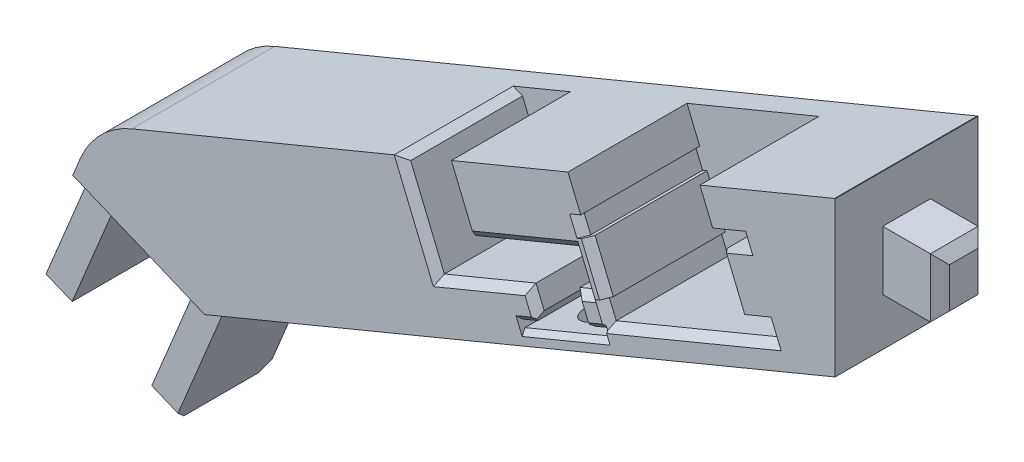
from build123d import *

# Parameters (mm, degrees)
BOSS_EXTRUDE1_DEPTH = 30
SKETCH4_W           = 30
SKETCH4_H           = 11.480502971
BOSS_EXTRUDE2_DEPTH = 50
CUT_EXTRUDE1_DEPTH  = 5
CUT_EXTRUDE3_DEPTH  = 6.480502971
FILLET1_R           = 10
CHAMFER3_SIZE       = 22.5
CHAMFER3_SIZE2      = 8.610377228
CHAMFER1_SIZE       = 15
CHAMFER1_SIZE2      = 20.645728807
CHAMFER2_SIZE2      = 20.645728807
CHAMFER2_SIZE       = 15
CUT_EXTRUDE4_DEPTH  = 25
CUT_EXTRUDE5_DEPTH  = 25
SKETCH9_W           = 20.645728807
SKETCH9_H           = 30
CUT_EXTRUDE6_DEPTH  = 40
SKETCH10_W          = 10
SKETCH10_H          = 12.413129657
BOSS_EXTRUDE3_DEPTH = 12
SKETCH11_W          = 20
SKETCH11_H          = 25.5
CUT_EXTRUDE7_DEPTH  = 4
SKETCH12_W          = 30
SKETCH12_H          = 31
CUT_EXTRUDE8_DEPTH  = 2
CHAMFER4_SIZE       = 1.5
CUT_EXTRUDE9_DEPTH  = 30
SKETCH14_W          = 5.95
SKETCH14_H          = 19.8
BOSS_EXTRUDE4_DEPTH = 30
FILLET2_R           = 20
CHAMFER5_SIZE       = 2
CHAMFER6_SIZE       = 1.5
BOSS_EXTRUDE5_DEPTH = 25.5
SKETCH16_W          = 4.6
SKETCH16_H          = 2.6
BOSS_EXTRUDE6_DEPTH = 10
CHAMFER7_SIZE       = 1
FILLET3_R           = 5


# Some blends are built 0.0001 mm under size
with BuildPart() as part:
    # Sketch1 → Boss-Extrude1 (new body)
    with BuildSketch(Plane.XY):
        Polygon((0, 216.478440058), (-153.073372946, 153.073372946), (-216.478440058, 0), (-244.194826034, 0), (-244.194826034, 11.480502971), (-176.034378888, 176.034378888), (0, 248.950206067), align=None)
    extrude(amount=BOSS_EXTRUDE1_DEPTH)

    # Sketch4 → Boss-Extrude2 (add)
    with BuildSketch(Plane.ZY.offset(244.194826034)):
        with Locations((15, 5.740251485)):
            Rectangle(SKETCH4_W, SKETCH4_H)
    extrude(amount=BOSS_EXTRUDE2_DEPTH)

    # Sketch5 → Cut-Extrude1 (cut)
    with BuildSketch(Plane(origin=(0, 11.480502971, 0), x_dir=(1, 0, 0), z_dir=(0, 1, 0))):
        with BuildLine():
            Line((-281.694826034, -6), (-256.694826034, -6))
            ThreePointArc((-256.694826034, -6), (-247.694826034, -15), (-256.694826034, -24))
            Line((-256.694826034, -24), (-281.694826034, -24))
            ThreePointArc((-281.694826034, -24), (-290.694826034, -15), (-281.694826034, -6))
        make_face()
    extrude(amount=-CUT_EXTRUDE1_DEPTH, mode=Mode.SUBTRACT)

    # Sketch7 → Cut-Extrude3 (cut)
    with BuildSketch(Plane(origin=(0, 6.480502971, 0), x_dir=(1, 0, 0), z_dir=(0, 1, 0))):
        with BuildLine():
            Line((-256.694826034, -11.5), (-281.694826034, -11.5))
            ThreePointArc((-281.694826034, -11.5), (-285.194826034, -15), (-281.694826034, -18.5))
            Line((-281.694826034, -18.5), (-256.694826034, -18.5))
            ThreePointArc((-256.694826034, -18.5), (-253.194826034, -15), (-256.694826034, -11.5))
        make_face()
    extrude(amount=-CUT_EXTRUDE3_DEPTH, mode=Mode.SUBTRACT)

    # Fillet1
    fillet1_edges = [part.edges().sort_by_distance(p)[0] for p in [
        (-294.194826034, 5.740251485, 0),
        (-294.194826034, 5.740251485, 30),
    ]]
    fillet(fillet1_edges, radius=FILLET1_R)

    # Chamfer3
    chamfer3_edges = [part.edges().sort_by_distance(p)[0] for p in [
        (0, 248.950206067, 15),
    ]]
    chamfer3_side = [part.faces().sort_by_distance(p)[0] for p in [
        (-88.017189444, 212.492292478, 15),
    ]]
    chamfer(chamfer3_edges, length=CHAMFER3_SIZE, length2=CHAMFER3_SIZE2, reference=chamfer3_side[0])

    # Chamfer1
    chamfer1_edges = [part.edges().sort_by_distance(p)[0] for p in [
        (0, 228.409134449, 0),
    ]]
    chamfer1_side = [part.faces().sort_by_distance(p)[0] for p in [
        (0, 228.409134449, 15),
    ]]
    chamfer(chamfer1_edges, length=CHAMFER1_SIZE, length2=CHAMFER1_SIZE2, reference=chamfer1_side[0])

    # Chamfer2
    chamfer2_edges = [part.edges().sort_by_distance(p)[0] for p in [
        (0, 228.409134449, 30),
    ]]
    chamfer2_side = [part.faces().sort_by_distance(p)[0] for p in [
        (0, 228.409134449, 29.7),
    ]]
    chamfer(chamfer2_edges, length=CHAMFER2_SIZE - 0.0001, length2=CHAMFER2_SIZE2 - 0.0001, reference=chamfer2_side[0])  # a hair under: the kernel refuses the full size

    # Sketch3 → Cut-Extrude4 (cut)
    with BuildSketch(Plane.XY.offset(30)):
        Polygon((-186.689323664, 71.91728881), (-182.86248934, 81.156084136), (-192.101284666, 84.982918459), (-184.129988769, 104.227329121), (-202.60757942, 111.880997769), (-206.434413743, 102.642202444), (-194.423979821, 97.667317823), (-203.608382197, 75.494209043), (-197.14122547, 72.815425016), (-195.928118989, 75.744123134), align=None)
        Polygon((-81.156084136, 182.86248934), (-71.91728881, 186.689323664), (-75.744123134, 195.928118989), (-72.815425016, 197.14122547), (-75.494209043, 203.608382197), (-97.667317823, 194.423979821), (-102.642202444, 206.434413743), (-111.880997769, 202.60757942), (-106.906113148, 190.597145497), (-104.227329121, 184.129988769), (-84.982918459, 192.101284666), align=None)
    extrude(amount=-CUT_EXTRUDE4_DEPTH, mode=Mode.SUBTRACT)

    # Sketch8 → Cut-Extrude5 (cut)
    with BuildSketch(Plane.XY.offset(30)):
        Polygon((-68.130369257, 193.669878104), (-69.661102986, 197.365396234), (-68.737223454, 197.748079667), (-72.564057777, 206.986874992), (-73.48793731, 206.604191559), (-75.018671039, 210.29970969), (-74.094791507, 210.682393122), (-76.773575533, 217.149549849), (-49.057189558, 228.63005282), (-46.378405531, 222.162896093), (-40.835128336, 224.458996687), (-39.304394607, 220.763478557), (-44.847671802, 218.467377963), (-41.020837478, 209.228582638), (-35.477560283, 211.524683232), (-33.946826554, 207.829165102), align=None)
    extrude(amount=-CUT_EXTRUDE5_DEPTH, mode=Mode.SUBTRACT)

    # Sketch9 → Cut-Extrude6 (cut)
    with BuildSketch(Plane(origin=(0, 240.339828839, 0), x_dir=(1, 0, 0), z_dir=(0, 1, 0))):
        with Locations((-10.322864404, -15)):
            Rectangle(SKETCH9_W, SKETCH9_H)
    extrude(amount=-CUT_EXTRUDE6_DEPTH, mode=Mode.SUBTRACT)


with BuildPart() as cut_extrude6_kept_piece:
    # of the separate pieces the step leaves, the one the design keeps (cut_extrude6_pieces_kept)
    add(part.part.solids().sort_by_distance((-20.787289482, 240.339828839, 30))[0])

    # Sketch10 → Boss-Extrude3 (add)
    with BuildSketch(Plane(origin=(-20.645728807, 0, 0), x_dir=(0, 0, -1), z_dir=(1, 0, 0))):
        with Locations((-15, 224.13326401)):
            Rectangle(SKETCH10_W, SKETCH10_H)
    extrude(amount=BOSS_EXTRUDE3_DEPTH)

    # Sketch11 → Cut-Extrude7 (cut)
    with BuildSketch(Plane(origin=(-76.536686473, 184.775906502, 0), x_dir=(0.9238795325112865, 0.38268343236509045, 0), z_dir=(0.38268343236509045, -0.9238795325112865, 0))):
        with Locations((0, 17.25)):
            Rectangle(SKETCH11_W, SKETCH11_H)
    extrude(amount=-CUT_EXTRUDE7_DEPTH, mode=Mode.SUBTRACT)

    # Sketch12 → Cut-Extrude8 (cut)
    with BuildSketch(Plane(origin=(-184.775906502, 76.536686473, 0), x_dir=(0, 0, -1), z_dir=(0.9238795325112872, -0.38268343236508917, 0))):
        with Locations((-15, 0.5)):
            Rectangle(SKETCH12_W, SKETCH12_H)
    extrude(amount=-CUT_EXTRUDE8_DEPTH, mode=Mode.SUBTRACT)

    # Chamfer4
    # the kernel refuses this chamfer: 1.5 mm, written as the material it takes off along each edge
    with BuildSketch(Plane(origin=(-111.880997769, 202.60757942, 33.857524482), x_dir=(-0.9340524457212702, -0.35713586860201213, 0), z_dir=(0, 0, -1)), Plane(origin=(-206.434413743, 102.642202444, 33.857524482), x_dir=(-0.4079416238599721, -0.9130080128468145, 0), z_dir=(0, 0, -1)), Plane(origin=(-82.686817865, 186.55800747, 5), x_dir=(-0.9130080128468199, -0.40794162385996025, 0), z_dir=(0, 0, 1)), Plane(origin=(-184.710248405, 81.921451, 33.857524482), x_dir=(0.40794162385996363, 0.9130080128468183, 0), z_dir=(0, 0, -1)), Plane(origin=(-188.537082729, 72.682655675, 5), x_dir=(-0.3571358686019868, -0.9340524457212799, 0), z_dir=(0, 0, 1))) as chamfer4_piece_1:
        Polygon((CHAMFER4_SIZE * 0.999621916911, -CHAMFER4_SIZE * 0.0274958766106), (-CHAMFER4_SIZE * 0.0274958766106, -CHAMFER4_SIZE * 0.999621916911), (0, 0), align=None)
    extrude(amount=28.857524482, mode=Mode.SUBTRACT)
    with BuildSketch(Plane(origin=(-102.642202444, 206.434413743, 33.857524482), x_dir=(0.913008012846816, 0.4079416238599687, 0), z_dir=(0, 0, -1)), Plane(origin=(-202.60757942, 111.880997769, 33.857524482), x_dir=(0.357135868602009, 0.9340524457212713, 0), z_dir=(0, 0, -1)), Plane(origin=(-73.44802254, 190.384841794, 33.857524482), x_dir=(-0.40794162385996025, 0.9130080128468199, 0), z_dir=(0, 0, -1))) as chamfer4_piece_2:
        Polygon((CHAMFER4_SIZE * 0.999621916911, CHAMFER4_SIZE * 0.0274958766106), (-CHAMFER4_SIZE * 0.0274958766106, CHAMFER4_SIZE * 0.999621916911), (0, 0), align=None)
    extrude(amount=28.857524482, mode=Mode.SUBTRACT)
    with BuildSketch(Plane(origin=(-86.459129168, 195.665172581, 30), x_dir=(-0.9235302292840447, -0.38253874623098655, 0.027495876610586726), z_dir=(0.3826834323650907, -0.9238795325112864, 0)), Plane(origin=(-71.971811831, 186.820953879, 30), x_dir=(0.9235302292840449, 0.38253874623098627, 0.027495876610586726), z_dir=(-0.3826834323650905, 0.9238795325112865, 0))) as chamfer4_piece_3:
        Polygon((CHAMFER4_SIZE * 0.999621916911, CHAMFER4_SIZE * 0.0274958766106), (-CHAMFER4_SIZE * 0.0274958766106, CHAMFER4_SIZE * 0.999621916911), (0, 0), align=None)
    extrude(amount=13.715048964, mode=Mode.SUBTRACT)
    with BuildSketch(Plane(origin=(-79.308011049, 194.45190828, 30), x_dir=(0.3825387462309865, -0.9235302292840447, 0.027495876610586726), z_dir=(0.9238795325112864, 0.3826834323650907, 0)), Plane(origin=(-197.14122547, 72.815425016, 30), x_dir=(0.9235302292840416, -0.3825387462309942, 0.02749587661058663), z_dir=(0.38268343236509833, 0.9238795325112832, 0))) as chamfer4_piece_4:
        Polygon((CHAMFER4_SIZE * 0.999621916911, CHAMFER4_SIZE * 0.0274958766106), (-CHAMFER4_SIZE * 0.0274958766106, CHAMFER4_SIZE * 0.999621916911), (0, 0), align=None)
    extrude(amount=7.027524482, mode=Mode.SUBTRACT)
    with BuildSketch(Plane(origin=(-72.815425016, 197.14122547, 30), x_dir=(0.923530229284045, 0.38253874623098577, 0.027495876610586726), z_dir=(-0.3826834323650899, 0.9238795325112867, 0)), Plane(origin=(-203.608382197, 75.494209043, 30), x_dir=(-0.3825387462309937, -0.9235302292840417, 0.027495876610586955), z_dir=(0.9238795325112835, -0.382683432365098, 0))) as chamfer4_piece_5:
        Polygon((CHAMFER4_SIZE * 0.999621916911, CHAMFER4_SIZE * 0.0274958766106), (-CHAMFER4_SIZE * 0.0274958766106, CHAMFER4_SIZE * 0.999621916911), (0, 0), align=None)
    extrude(amount=7, mode=Mode.SUBTRACT)
    with BuildSketch(Plane(origin=(-75.494209043, 203.608382197, 30), x_dir=(-0.38253874623098766, 0.9235302292840444, 0.027495876610586726), z_dir=(-0.923879532511286, -0.3826834323650918, 0)), Plane(origin=(-192.947769111, 101.231205738, 30), x_dir=(-0.9235302292840468, 0.38253874623098166, 0.027495876610586726), z_dir=(-0.3826834323650858, -0.9238795325112884, 0))) as chamfer4_piece_6:
        Polygon((CHAMFER4_SIZE * 0.999621916911, CHAMFER4_SIZE * 0.0274958766106), (-CHAMFER4_SIZE * 0.0274958766106, CHAMFER4_SIZE * 0.999621916911), (0, 0), align=None)
    extrude(amount=27.857524482, mode=Mode.SUBTRACT)
    with BuildSketch(Plane(origin=(-96.191107114, 190.860091906, 30), x_dir=(0.9235302292840402, 0.3825387462309975, 0.027495876610586768), z_dir=(-0.3826834323651017, 0.9238795325112819, 0))) as chamfer4_piece_7:
        Polygon((CHAMFER4_SIZE * 0.999621916911, CHAMFER4_SIZE * 0.0274958766106), (-CHAMFER4_SIZE * 0.0274958766106, CHAMFER4_SIZE * 0.999621916911), (0, 0), align=None)
    extrude(amount=20.715048964, mode=Mode.SUBTRACT)
    with BuildSketch(Plane(origin=(-104.227329121, 184.129988769, 30), x_dir=(0.02540287762893928, 0.010522216437210534, -0.9996219169112979), z_dir=(-0.38268343236508334, 0.9238795325112895, 0)), Plane(origin=(-184.129988769, 104.227329121, 30), x_dir=(0.38253874623098305, 0.9235302292840462, 0.027495876610586726), z_dir=(-0.9238795325112878, 0.3826834323650872, 0))) as chamfer4_piece_8:
        Polygon((CHAMFER4_SIZE * 0.999621916911, CHAMFER4_SIZE * 0.0274958766106), (-CHAMFER4_SIZE * 0.0274958766105, CHAMFER4_SIZE * 0.999621916911), (0, 0), align=None)
    extrude(amount=23.857524482, mode=Mode.SUBTRACT)
    with BuildSketch(Plane(origin=(-104.227329121, 184.129988769, 30), x_dir=(0.38253874623098766, -0.9235302292840444, 0.027495876610586726), z_dir=(0.923879532511286, 0.3826834323650918, 0)), Plane(origin=(-193.577495375, 81.419030544, 30), x_dir=(0.9235302292840456, -0.38253874623098455, 0.027495876610586726), z_dir=(0.3826834323650887, 0.9238795325112873, 0))) as chamfer4_piece_9:
        Polygon((CHAMFER4_SIZE * 0.999621916911, CHAMFER4_SIZE * 0.0274958766106), (-CHAMFER4_SIZE * 0.0274958766106, CHAMFER4_SIZE * 0.999621916911), (0, 0), align=None)
    extrude(amount=24.687524482, mode=Mode.SUBTRACT)
    with BuildSketch(Plane(origin=(-209.998301658, 104.118413153, 30), x_dir=(0.010522216437226423, 0.025402877628977135, -0.9996219169112968), z_dir=(0.9238795325112867, -0.38268343236508984, 0))) as chamfer4_piece_10:
        Polygon((CHAMFER4_SIZE * 0.999621916911, -CHAMFER4_SIZE * 0.0274958766106), (-CHAMFER4_SIZE * 0.0274958766106, -CHAMFER4_SIZE * 0.999621916911), (0, 0), align=None)
    extrude(amount=20.715048964, mode=Mode.SUBTRACT)
    with BuildSketch(Plane(origin=(-199.492006904, 77.220333843, 30), x_dir=(-0.38253874623098383, -0.9235302292840458, 0.027495876610586722), z_dir=(0.9238795325112875, -0.38268343236508806, 0)), Plane(origin=(-181.14636049, 80.445240291, 30), x_dir=(0.38253874623098577, 0.923530229284045, 0.027495876610586726), z_dir=(-0.9238795325112867, 0.38268343236508995, 0))) as chamfer4_piece_11:
        Polygon((CHAMFER4_SIZE * 0.999621916911, CHAMFER4_SIZE * 0.0274958766106), (-CHAMFER4_SIZE * 0.0274958766106, CHAMFER4_SIZE * 0.999621916911), (0, 0), align=None)
    extrude(amount=15.715048964, mode=Mode.SUBTRACT)
    with BuildSketch(Plane(origin=(-33.946826554, 207.829165102, 30), x_dir=(0.38253874623098433, -0.9235302292840456, 0.027495876610586674), z_dir=(-0.9238795325112873, -0.38268343236508856, 0))) as chamfer4_piece_12:
        Polygon((CHAMFER4_SIZE * 0.999621916911, -CHAMFER4_SIZE * 0.0274958766106), (-CHAMFER4_SIZE * 0.0274958766106, -CHAMFER4_SIZE * 0.999621916911), (0, 0), align=None)
    extrude(amount=37, mode=Mode.SUBTRACT)
    with BuildSketch(Plane(origin=(-35.477560283, 211.524683232, 30), x_dir=(0.9235302292840445, 0.38253874623098716, 0.02749587661058684), z_dir=(0.3826834323650914, -0.9238795325112861, 0)), Plane(origin=(-40.835128336, 224.458996687, 30), x_dir=(0.923530229284045, 0.3825387462309857, 0.027495876610586608), z_dir=(0.3826834323650899, -0.9238795325112867, 0)), Plane(origin=(-73.48793731, 206.604191559, 30), x_dir=(-0.9235302292840456, -0.38253874623098416, 0.027495876610586722), z_dir=(-0.3826834323650884, 0.9238795325112874, 0)), Plane(origin=(-68.130369257, 193.669878104, 30), x_dir=(-0.9235302292840445, -0.38253874623098727, 0.027495876610586726), z_dir=(-0.3826834323650914, 0.9238795325112861, 0))) as chamfer4_piece_13:
        Polygon((CHAMFER4_SIZE * 0.999621916911, -CHAMFER4_SIZE * 0.0274958766106), (-CHAMFER4_SIZE * 0.0274958766106, -CHAMFER4_SIZE * 0.999621916911), (0, 0), align=None)
    extrude(amount=4, mode=Mode.SUBTRACT)
    with BuildSketch(Plane(origin=(-46.323882511, 222.031265878, 30), x_dir=(0.9235302292840456, 0.38253874623098433, 0.027495876610586726), z_dir=(0.3826834323650885, -0.9238795325112873, 0))) as chamfer4_piece_14:
        Polygon((CHAMFER4_SIZE * 0.999621916911, -CHAMFER4_SIZE * 0.0274958766106), (-CHAMFER4_SIZE * 0.0274958766106, -CHAMFER4_SIZE * 0.999621916911), (0, 0), align=None)
    extrude(amount=17.715048964, mode=Mode.SUBTRACT)
    with BuildSketch(Plane(origin=(-71.339214307, 193.577337555, 30), x_dir=(0.923530229284045, 0.38253874623098577, 0.027495876610586726), z_dir=(-0.3826834323650899, 0.9238795325112867, 0))) as chamfer4_piece_15a_section:
        Polygon((CHAMFER4_SIZE * 0.999621916911, CHAMFER4_SIZE * 0.0274958766106), (-CHAMFER4_SIZE * 0.0274958766106, CHAMFER4_SIZE * 0.999621916911), (0, 0), align=None)
    chamfer4_piece_15a = extrude(amount=10.857524482, mode=Mode.PRIVATE)
    chamfer4_piece_15a = split(chamfer4_piece_15a, bisect_by=Plane(origin=(-72.358390643, 197.330535305, 29.50530956), z_dir=(0.3826834323650907, -0.9238795325112864, 0)), keep=Keep.TOP, mode=Mode.PRIVATE)
    with BuildSketch(Plane(origin=(-79.308011049, 194.45190828, 30), x_dir=(0.3825387462309865, -0.9235302292840447, 0.027495876610586726), z_dir=(0.9238795325112864, 0.3826834323650907, 0))) as chamfer4_piece_15b_section:
        Polygon((CHAMFER4_SIZE * 0.999621916911, CHAMFER4_SIZE * 0.0274958766106), (-CHAMFER4_SIZE * 0.0274958766106, CHAMFER4_SIZE * 0.999621916911), (0, 0), align=None)
    chamfer4_piece_15b = extrude(amount=10.885048964, mode=Mode.PRIVATE)
    chamfer4_piece_15b = split(chamfer4_piece_15b, bisect_by=Plane(origin=(-72.62611518, 196.684191097, 29.50530956), z_dir=(0.9238795325112867, 0.3826834323650899, 0)), keep=Keep.TOP, mode=Mode.PRIVATE)
    chamfer4_piece_15 = chamfer4_piece_15a & chamfer4_piece_15b
    add(chamfer4_piece_15, mode=Mode.SUBTRACT)
    with BuildSketch(Plane(origin=(-71.930321128, 205.084592907, 30), x_dir=(-0.38253874623098766, 0.9235302292840444, 0.027495876610586726), z_dir=(-0.923879532511286, -0.3826834323650918, 0))) as chamfer4_piece_16a_section:
        Polygon((CHAMFER4_SIZE * 0.999621916911, CHAMFER4_SIZE * 0.0274958766106), (-CHAMFER4_SIZE * 0.0274958766106, CHAMFER4_SIZE * 0.999621916911), (0, 0), align=None)
    chamfer4_piece_16a = extrude(amount=31.715048964, mode=Mode.PRIVATE)
    chamfer4_piece_16a = split(chamfer4_piece_16a, bisect_by=Plane(origin=(-75.683518878, 204.06541657, 29.50530956), z_dir=(0.9238795325112867, 0.3826834323650899, 0)), keep=Keep.TOP, mode=Mode.PRIVATE)
    with BuildSketch(Plane(origin=(-72.815425016, 197.14122547, 30), x_dir=(0.923530229284045, 0.38253874623098577, 0.027495876610586726), z_dir=(-0.3826834323650899, 0.9238795325112867, 0))) as chamfer4_piece_16b_section:
        Polygon((CHAMFER4_SIZE * 0.999621916911, CHAMFER4_SIZE * 0.0274958766106), (-CHAMFER4_SIZE * 0.0274958766106, CHAMFER4_SIZE * 0.999621916911), (0, 0), align=None)
    chamfer4_piece_16b = extrude(amount=10.857524482, mode=Mode.PRIVATE)
    chamfer4_piece_16b = split(chamfer4_piece_16b, bisect_by=Plane(origin=(-75.03717467, 203.797692033, 29.50530956), z_dir=(-0.3826834323650918, 0.923879532511286, 0)), keep=Keep.TOP, mode=Mode.PRIVATE)
    chamfer4_piece_16 = chamfer4_piece_16a & chamfer4_piece_16b
    add(chamfer4_piece_16, mode=Mode.SUBTRACT)
    with BuildSketch(Plane(origin=(-102.751118412, 180.566100854, 30), x_dir=(0.02540287762897721, 0.010522216437226244, -0.9996219169112968), z_dir=(-0.38268343236508334, 0.9238795325112895, 0))) as chamfer4_piece_17a_section:
        Polygon((CHAMFER4_SIZE * 0.999621916911, CHAMFER4_SIZE * 0.0274958766106), (-CHAMFER4_SIZE * 0.0274958766106, CHAMFER4_SIZE * 0.999621916911), (0, 0), align=None)
    chamfer4_piece_17a = extrude(amount=27.715048964, mode=Mode.PRIVATE)
    chamfer4_piece_17a = split(chamfer4_piece_17a, bisect_by=Plane(origin=(-104.684363494, 183.940678934, 29.50530956), z_dir=(0.3826834323650918, -0.923879532511286, 0)), keep=Keep.TOP, mode=Mode.PRIVATE)
    with BuildSketch(Plane(origin=(-107.791217036, 182.65377806, 30), x_dir=(0.38253874623098766, -0.9235302292840444, 0.027495876610586726), z_dir=(0.923879532511286, 0.3826834323650918, 0))) as chamfer4_piece_17b_section:
        Polygon((CHAMFER4_SIZE * 0.999621916911, CHAMFER4_SIZE * 0.0274958766106), (-CHAMFER4_SIZE * 0.0274958766106, CHAMFER4_SIZE * 0.999621916911), (0, 0), align=None)
    chamfer4_piece_17b = extrude(amount=28.545048964, mode=Mode.PRIVATE)
    chamfer4_piece_17b = split(chamfer4_piece_17b, bisect_by=Plane(origin=(-104.038019286, 183.672954397, 29.50530956), z_dir=(-0.9238795325112906, -0.3826834323650806, 0)), keep=Keep.TOP, mode=Mode.PRIVATE)
    chamfer4_piece_17 = chamfer4_piece_17a & chamfer4_piece_17b
    add(chamfer4_piece_17, mode=Mode.SUBTRACT)
    with BuildSketch(Plane(origin=(-180.566100854, 102.751118412, 30), x_dir=(0.38253874623098305, 0.9235302292840462, 0.027495876610586726), z_dir=(-0.9238795325112878, 0.3826834323650872, 0))) as chamfer4_piece_18a_section:
        Polygon((CHAMFER4_SIZE * 0.999621916911, CHAMFER4_SIZE * 0.0274958766106), (-CHAMFER4_SIZE * 0.0274958766106, CHAMFER4_SIZE * 0.999621916911), (0, 0), align=None)
    chamfer4_piece_18a = extrude(amount=27.715048964, mode=Mode.PRIVATE)
    chamfer4_piece_18a = split(chamfer4_piece_18a, bisect_by=Plane(origin=(-183.940678934, 104.684363494, 29.50530956), z_dir=(0.9238795325112873, -0.3826834323650887, 0)), keep=Keep.TOP, mode=Mode.PRIVATE)
    with BuildSketch(Plane(origin=(-193.577495375, 81.419030544, 30), x_dir=(0.9235302292840456, -0.38253874623098455, 0.027495876610586726), z_dir=(0.3826834323650887, 0.9238795325112873, 0))) as chamfer4_piece_18b_section:
        Polygon((CHAMFER4_SIZE * 0.999621916911, CHAMFER4_SIZE * 0.0274958766106), (-CHAMFER4_SIZE * 0.0274958766106, CHAMFER4_SIZE * 0.999621916911), (0, 0), align=None)
    chamfer4_piece_18b = extrude(amount=28.545048964, mode=Mode.PRIVATE)
    chamfer4_piece_18b = split(chamfer4_piece_18b, bisect_by=Plane(origin=(-183.672954397, 104.038019286, 29.50530956), z_dir=(0.3826834323650872, 0.9238795325112878, 0)), keep=Keep.TOP, mode=Mode.PRIVATE)
    chamfer4_piece_18 = chamfer4_piece_18a & chamfer4_piece_18b
    add(chamfer4_piece_18, mode=Mode.SUBTRACT)
    with BuildSketch(Plane(origin=(-207.172270112, 76.970419752, 30), x_dir=(-0.3825387462309937, -0.9235302292840417, 0.027495876610586955), z_dir=(0.9238795325112835, -0.382683432365098, 0))) as chamfer4_piece_19a_section:
        Polygon((CHAMFER4_SIZE * 0.999621916911, CHAMFER4_SIZE * 0.0274958766106), (-CHAMFER4_SIZE * 0.0274958766106, CHAMFER4_SIZE * 0.999621916911), (0, 0), align=None)
    chamfer4_piece_19a = extrude(amount=10.857524482, mode=Mode.PRIVATE)
    chamfer4_piece_19a = split(chamfer4_piece_19a, bisect_by=Plane(origin=(-203.797692033, 75.03717467, 29.50530956), z_dir=(-0.9238795325112884, 0.3826834323650858, 0)), keep=Keep.TOP, mode=Mode.PRIVATE)
    with BuildSketch(Plane(origin=(-192.947769111, 101.231205738, 30), x_dir=(-0.9235302292840468, 0.38253874623098166, 0.027495876610586726), z_dir=(-0.3826834323650858, -0.9238795325112884, 0))) as chamfer4_piece_19b_section:
        Polygon((CHAMFER4_SIZE * 0.999621916911, CHAMFER4_SIZE * 0.0274958766106), (-CHAMFER4_SIZE * 0.0274958766106, CHAMFER4_SIZE * 0.999621916911), (0, 0), align=None)
    chamfer4_piece_19b = extrude(amount=31.715048964, mode=Mode.PRIVATE)
    chamfer4_piece_19b = split(chamfer4_piece_19b, bisect_by=Plane(origin=(-204.06541657, 75.683518878, 29.50530956), z_dir=(-0.38268343236509805, -0.9238795325112835, 0)), keep=Keep.TOP, mode=Mode.PRIVATE)
    chamfer4_piece_19 = chamfer4_piece_19a & chamfer4_piece_19b
    add(chamfer4_piece_19, mode=Mode.SUBTRACT)
    with BuildSketch(Plane(origin=(-198.617436179, 69.251537101, 30), x_dir=(0.9235302292840416, -0.3825387462309942, 0.02749587661058663), z_dir=(0.38268343236509833, 0.9238795325112832, 0))) as chamfer4_piece_20a_section:
        Polygon((CHAMFER4_SIZE * 0.999621916911, CHAMFER4_SIZE * 0.0274958766106), (-CHAMFER4_SIZE * 0.0274958766106, CHAMFER4_SIZE * 0.999621916911), (0, 0), align=None)
    chamfer4_piece_20a = extrude(amount=10.885048964, mode=Mode.PRIVATE)
    chamfer4_piece_20a = split(chamfer4_piece_20a, bisect_by=Plane(origin=(-196.684191097, 72.62611518, 29.50530956), z_dir=(-0.38268343236509805, -0.9238795325112835, 0)), keep=Keep.TOP, mode=Mode.PRIVATE)
    with BuildSketch(Plane(origin=(-203.608382197, 75.494209043, 30), x_dir=(-0.3825387462309937, -0.9235302292840417, 0.027495876610586955), z_dir=(0.9238795325112835, -0.382683432365098, 0))) as chamfer4_piece_20b_section:
        Polygon((CHAMFER4_SIZE * 0.999621916911, CHAMFER4_SIZE * 0.0274958766106), (-CHAMFER4_SIZE * 0.0274958766106, CHAMFER4_SIZE * 0.999621916911), (0, 0), align=None)
    chamfer4_piece_20b = extrude(amount=10.857524482, mode=Mode.PRIVATE)
    chamfer4_piece_20b = split(chamfer4_piece_20b, bisect_by=Plane(origin=(-197.330535305, 72.358390643, 29.50530956), z_dir=(0.9238795325112832, -0.38268343236509833, 0)), keep=Keep.TOP, mode=Mode.PRIVATE)
    chamfer4_piece_20 = chamfer4_piece_20a & chamfer4_piece_20b
    add(chamfer4_piece_20, mode=Mode.SUBTRACT)
    with BuildSketch(Plane(origin=(-35.477560283, 211.524683232, 30), x_dir=(0.9235302292840445, 0.38253874623098716, 0.02749587661058684), z_dir=(0.3826834323650914, -0.9238795325112861, 0))) as chamfer4_piece_21a_section:
        Polygon((CHAMFER4_SIZE * 0.999621916911, -CHAMFER4_SIZE * 0.0274958766106), (-CHAMFER4_SIZE * 0.0274958766106, -CHAMFER4_SIZE * 0.999621916911), (0, 0), align=None)
    chamfer4_piece_21a = extrude(amount=7.857524482, mode=Mode.PRIVATE)
    chamfer4_piece_21a = split(chamfer4_piece_21a, bisect_by=Plane(origin=(-33.489792181, 208.018474937, 29.50530956), z_dir=(0.38268343236508856, -0.9238795325112873, 0)), keep=Keep.TOP, mode=Mode.PRIVATE)
    with BuildSketch(Plane(origin=(-30.382938639, 209.305375811, 30), x_dir=(0.3825387462309844, -0.9235302292840456, 0.027495876610586726), z_dir=(-0.9238795325112873, -0.38268343236508856, 0))) as chamfer4_piece_21b_section:
        Polygon((CHAMFER4_SIZE * 0.999621916911, -CHAMFER4_SIZE * 0.0274958766106), (-CHAMFER4_SIZE * 0.0274958766106, -CHAMFER4_SIZE * 0.999621916911), (0, 0), align=None)
    chamfer4_piece_21b = extrude(amount=40.857524482, mode=Mode.PRIVATE)
    chamfer4_piece_21b = split(chamfer4_piece_21b, bisect_by=Plane(origin=(-33.757516718, 207.372130729, 29.50530956), z_dir=(0.9238795325112861, 0.3826834323650914, 0)), keep=Keep.TOP, mode=Mode.PRIVATE)
    chamfer4_piece_21 = chamfer4_piece_21a & chamfer4_piece_21b
    add(chamfer4_piece_21, mode=Mode.SUBTRACT)
    with BuildSketch(Plane(origin=(-33.946826554, 207.829165102, 30), x_dir=(0.38253874623098433, -0.9235302292840456, 0.027495876610586674), z_dir=(-0.9238795325112873, -0.38268343236508856, 0))) as chamfer4_piece_22a_section:
        Polygon((CHAMFER4_SIZE * 0.999621916911, -CHAMFER4_SIZE * 0.0274958766106), (-CHAMFER4_SIZE * 0.0274958766106, -CHAMFER4_SIZE * 0.999621916911), (0, 0), align=None)
    chamfer4_piece_22a = extrude(amount=40.857524482, mode=Mode.PRIVATE)
    chamfer4_piece_22a = split(chamfer4_piece_22a, bisect_by=Plane(origin=(-67.941059421, 193.212843732, 29.50530956), z_dir=(-0.9238795325112861, -0.3826834323650914, 0)), keep=Keep.TOP, mode=Mode.PRIVATE)
    with BuildSketch(Plane(origin=(-66.654158548, 190.105990189, 30), x_dir=(-0.9235302292840445, -0.38253874623098727, 0.027495876610586726), z_dir=(-0.3826834323650914, 0.9238795325112861, 0))) as chamfer4_piece_22b_section:
        Polygon((CHAMFER4_SIZE * 0.999621916911, -CHAMFER4_SIZE * 0.0274958766106), (-CHAMFER4_SIZE * 0.0274958766106, -CHAMFER4_SIZE * 0.999621916911), (0, 0), align=None)
    chamfer4_piece_22b = extrude(amount=7.857524482, mode=Mode.PRIVATE)
    chamfer4_piece_22b = split(chamfer4_piece_22b, bisect_by=Plane(origin=(-68.587403629, 193.480568269, 29.50530956), z_dir=(0.38268343236508856, -0.9238795325112873, 0)), keep=Keep.TOP, mode=Mode.PRIVATE)
    chamfer4_piece_22 = chamfer4_piece_22a & chamfer4_piece_22b
    add(chamfer4_piece_22, mode=Mode.SUBTRACT)

    # Sketch13 → Cut-Extrude9 (cut)
    with BuildSketch(Plane(origin=(0, 0, 0), x_dir=(-1, 0, 0), z_dir=(0, 0, -1))):
        Polygon((153.073372946, 153.073372946), (216.478440058, 0), (308.555561475, 0), (180.789758921, 164.553875917), align=None)
    extrude(amount=-CUT_EXTRUDE9_DEPTH, mode=Mode.SUBTRACT)

    # Sketch14 → Boss-Extrude4 (add)
    with BuildSketch(Plane(origin=(31.702533556, 76.536686473, 0), x_dir=(0.9238795325112868, -0.38268343236508956, 0), z_dir=(-0.38268343236508956, -0.9238795325112868, 0))):
        with Locations((-227.025, 15)):
            Rectangle(SKETCH14_W, SKETCH14_H)
        with Locations((-202.975, 15)):
            Rectangle(SKETCH14_W, SKETCH14_H)
    extrude(amount=BOSS_EXTRUDE4_DEPTH)

    # Fillet2
    fillet2_edges = [cut_extrude6_kept_piece.edges().sort_by_distance(p)[0] for p in [
        (-176.034378888, 176.034378888, 15),
    ]]
    fillet(fillet2_edges, radius=FILLET2_R)

    # Chamfer5
    chamfer5_edges = [cut_extrude6_kept_piece.edges().sort_by_distance(p)[0] for p in [
        (-8.645728807, 217.926699182, 15),
        (-8.645728807, 224.13326401, 10),
        (-8.645728807, 230.339828839, 15),
        (-8.645728807, 224.13326401, 20),
        (-189.521720283, 135.69900673, 5.1),
        (-186.773178674, 134.560523519, 15),
        (-189.521720283, 135.69900673, 24.9),
        (-167.302417526, 126.495470182, 24.9),
        (-170.050959135, 127.633953393, 15),
        (-167.302417526, 126.495470182, 5.1),
    ]]
    chamfer(chamfer5_edges, length=CHAMFER5_SIZE)

    # Chamfer6
    chamfer6_edges = [cut_extrude6_kept_piece.edges().sort_by_distance(p)[0] for p in [
        (-70.650640615, 202.367477329, 30),
    ]]
    chamfer(chamfer6_edges, length=CHAMFER6_SIZE)

    # Sketch15 → Boss-Extrude5 (add)
    with BuildSketch(Plane.XY.offset(4.5)):
        Polygon((-85.775481798, 180.949072179), (-86.770458722, 183.351158963), (-82.15106106, 185.264576125), (-81.156084136, 182.86248934), align=None)
        Polygon((-68.292868072, 191.00482761), (-67.297891148, 188.602740826), (-71.91728881, 186.689323664), (-72.912265735, 189.091410449), align=None)
    extrude(amount=BOSS_EXTRUDE5_DEPTH)

    # Sketch16 → Boss-Extrude6 (add)
    with BuildSketch(Plane(origin=(-4.619397663, -1.913417162, 0), x_dir=(0, 0, -1), z_dir=(0.9238795325112874, 0.38268343236508845, 0))):
        with Locations((-27.7, 201.3)):
            Rectangle(SKETCH16_W, SKETCH16_H)
    extrude(amount=BOSS_EXTRUDE6_DEPTH)

    # Chamfer7
    chamfer7_edges = [cut_extrude6_kept_piece.edges().sort_by_distance(p)[0] for p in [
        (-70.597854182, 191.565420183, 30),
        (-85.689426346, 185.314286315, 30),
        (-77.531663397, 187.177993287, 30),
    ]]
    chamfer(chamfer7_edges, length=CHAMFER7_SIZE)

    # Fillet3
    fillet3_edges = [cut_extrude6_kept_piece.edges().sort_by_distance(p)[0] for p in [
        (-72.414777273, 187.890367056, 4.5),
        (-81.653572598, 184.063532733, 4.5),
        (-72.414777273, 187.890367056, 25.4),
        (-81.653572598, 184.063532733, 25.4),
    ]]
    fillet(fillet3_edges, radius=FILLET3_R - 0.0001)  # a hair under: the kernel refuses the full size


solid = cut_extrude6_kept_piece.part
